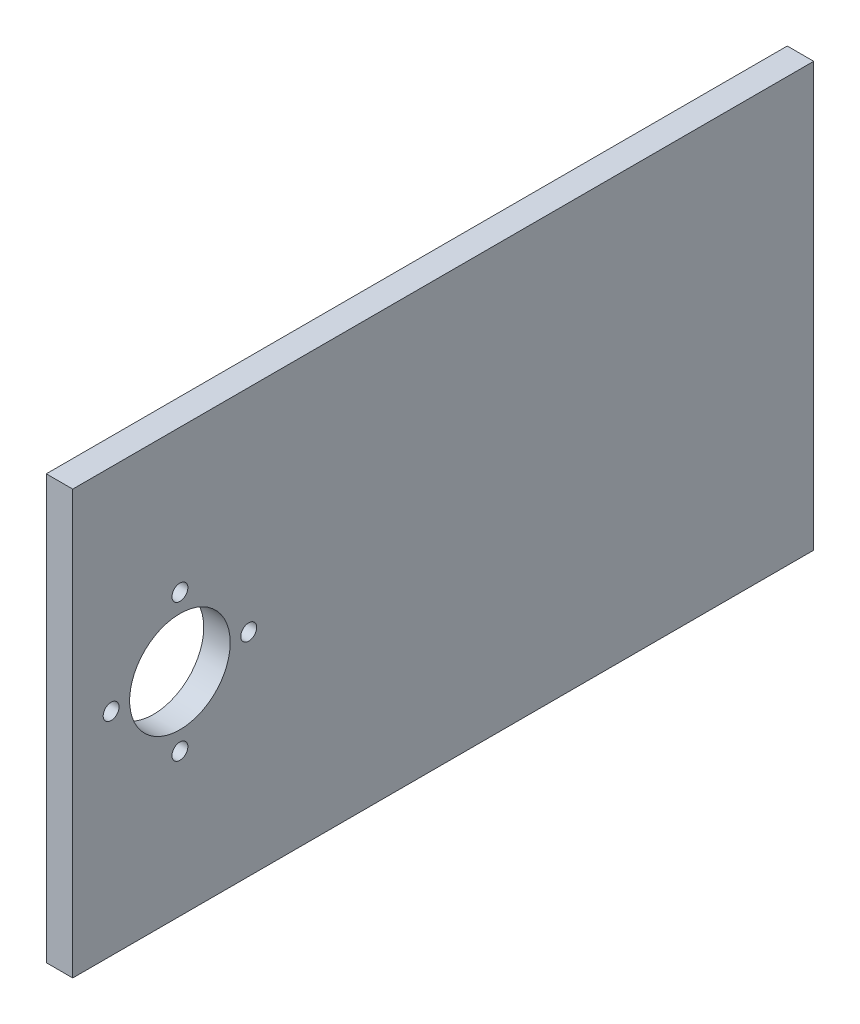
from build123d import *

# Parameters (mm, degrees)
SKETCH1_W           = 80
SKETCH1_H           = 140
SKETCH1_R           = 1.5
SKETCH1_R_2         = 9.5
BOSS_EXTRUDE1_DEPTH = 5


with BuildPart() as part:
    # Sketch1 → Boss-Extrude1 (new body)
    with BuildSketch(Plane.YZ):
        Rectangle(SKETCH1_W, SKETCH1_H)
        with Locations((0, 62.75)):
            Circle(SKETCH1_R, mode=Mode.SUBTRACT)
        with Locations((0, 36.75)):
            Circle(SKETCH1_R, mode=Mode.SUBTRACT)
        with Locations((-13, 49.75)):
            Circle(SKETCH1_R, mode=Mode.SUBTRACT)
        with Locations((13, 49.75)):
            Circle(SKETCH1_R, mode=Mode.SUBTRACT)
        with Locations((0, 49.75)):
            Circle(SKETCH1_R_2, mode=Mode.SUBTRACT)
    extrude(amount=BOSS_EXTRUDE1_DEPTH)


solid = part.part
